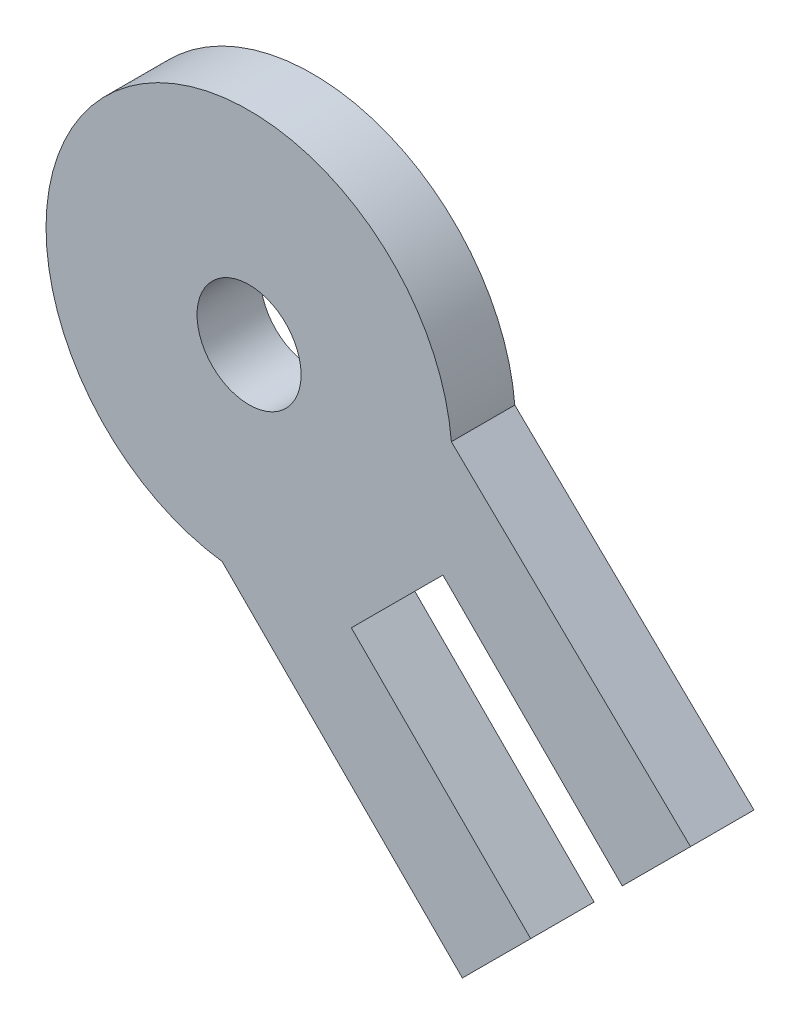
from build123d import *

# Parameters (mm, degrees)
SKETCH2_R           = 4.1
BOSS_EXTRUDE1_DEPTH = 5


with BuildPart() as part:
    # Sketch2 → Boss-Extrude1 (new body)
    with BuildSketch(Plane.XY):
        with BuildLine():
            Line((105.627618033, 446.471451896), (111.008825877, 451.845130204))
            Line((111.008825877, 451.845130204), (92.160301493, 470.056759802))
            ThreePointArc((92.160301493, 470.056759802), (65.179582693, 480.288200919), (74.099706372, 452.846025935))
            Line((74.099706372, 452.846025935), (93.028873299, 433.890335677))
            Line((93.028873299, 433.890335677), (98.410081143, 439.264013985))
            Line((98.410081143, 439.264013985), (84.277849945, 453.416047103))
            Line((84.277849945, 453.416047103), (91.495386835, 460.623485014))
            Line((91.495386835, 460.623485014), (105.627618033, 446.471451896))
        make_face()
        with Locations((76.217484184, 468.705250921)):
            Circle(SKETCH2_R, mode=Mode.SUBTRACT)
    extrude(amount=BOSS_EXTRUDE1_DEPTH)


solid = part.part
